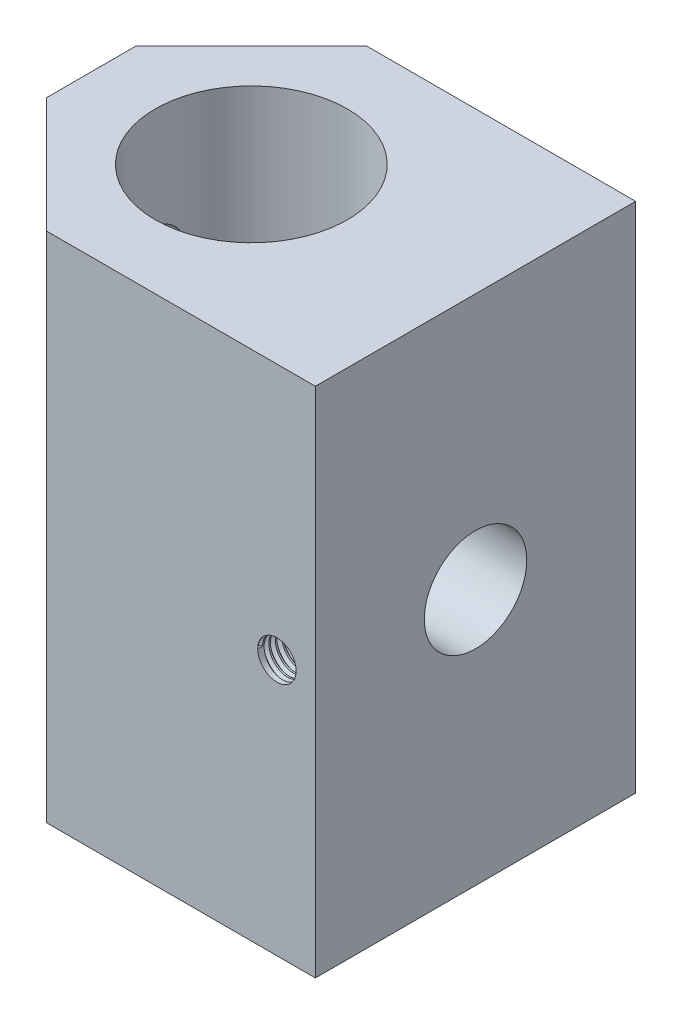
from build123d import *
from build123d.topology import SkipClean

# Parameters (mm, degrees)
SKETCH1_W           = 30
SKETCH1_H           = 25
SKETCH1_R           = 7.5
BOSS_EXTRUDE1_DEPTH = 20
SKETCH2_R           = 4
CUT_EXTRUDE1_DEPTH  = 9
SKETCH3_R           = 2
CUT_EXTRUDE2_DEPTH  = 10
CHAMFER1_SIZE       = 9
SKETCH4_R           = 1.5
CUT_EXTRUDE3_DEPTH  = 11
THREAD1_PITCH       = 0.5


with BuildPart() as part:
    # Sketch1 → Boss-Extrude1 (new, symmetric)
    with BuildSketch(Plane(origin=(0, 0, 0), x_dir=(1, 0, 0), z_dir=(0, 1, 0))):
        Rectangle(SKETCH1_W, SKETCH1_H)
        with Locations(Location((-2.5, 0, 0), (0, 0, 270))):
            Circle(SKETCH1_R, mode=Mode.SUBTRACT)
    extrude(amount=BOSS_EXTRUDE1_DEPTH, both=True)

    # Sketch2 → Cut-Extrude1 (cut)
    with BuildSketch(Plane(origin=(15, 0, 0), x_dir=(0, 0, -1), z_dir=(1, 0, 0))):
        Circle(SKETCH2_R)
    extrude(amount=-CUT_EXTRUDE1_DEPTH, mode=Mode.SUBTRACT)

    # Sketch3 → Cut-Extrude2 (cut)
    with BuildSketch(Plane.ZY.offset(15)):
        with Locations((0, -10)):
            Circle(SKETCH3_R)
        with Locations((0, 10)):
            Circle(SKETCH3_R)
    extrude(amount=-CUT_EXTRUDE2_DEPTH, mode=Mode.SUBTRACT)

    # Chamfer1
    chamfer1_edges = [part.edges().sort_by_distance(p)[0] for p in [
        (-15, 0, 12.5),
        (-15, 0, -12.5),
    ]]
    chamfer(chamfer1_edges, length=CHAMFER1_SIZE)

    # Sketch4 → Cut-Extrude3 (cut)
    with BuildSketch(Plane.XY.offset(12.5)):
        with Locations((12, 0)):
            Circle(SKETCH4_R)
    extrude(amount=-CUT_EXTRUDE3_DEPTH, mode=Mode.SUBTRACT)

    # Thread1: the profile of Thread Profile1 profile screwed along a right-hand helix of 22 turns, 6 arcs to a turn; built about Z, then put on its axis
    with SkipClean():  # the faces are left unmerged after this step: merging them gives an invalid solid
        thread1_z = Axis((0, 0, 0), (0, 0, 1))
        thread1_corners = [(1.4997, 0, -0.000173205), (1.770632938, 0, 0.156249999), (1.770632938, 0, 0.218749999), (1.4997, 0, 0.375173204)]
        with BuildLine(mode=Mode.PRIVATE) as thread1_profile:
            Line(thread1_corners[0], thread1_corners[1])
            Line(thread1_corners[1], thread1_corners[2])
            Line(thread1_corners[2], thread1_corners[3])
            Line(thread1_corners[3], thread1_corners[0])
        thread1_cap = Face(thread1_profile.wire())
        thread1_turn_angles = [0, 30, 60, 90, 120, 150, 180, 210, 240, 270, 300, 330, 360]
        thread1_turn_weights = [1, 0.8660254037844387, 1, 0.8660254037844387, 1, 0.8660254037844387, 1, 0.8660254037844387, 1, 0.8660254037844387, 1, 0.8660254037844387, 1]
        thread1_turn_rails = [Edge.make_bspline([Vector(p[0], p[1], 0).rotate(thread1_z, thread1_turn_angles[k]) / thread1_turn_weights[k] + Vector(0, 0, p[2] + THREAD1_PITCH * thread1_turn_angles[k] / 360) for k in range(13)], [0, 0, 0, 1, 1, 2, 2, 3, 3, 4, 4, 5, 5, 6, 6, 6], 2, thread1_turn_weights) for p in thread1_corners]
        thread1_turn_sides = [Face.make_surface_from_curves(thread1_turn_rails[p[0]], thread1_turn_rails[p[1]]) for p in [(0, 1), (1, 2), (2, 3), (3, 0)]]
        thread1 = Plane(origin=(12, 0, 12.5), x_dir=(-1, 0, 0), z_dir=(0, 0, -1)) * Solid(Shell([*[p.moved(Location((0, 0, THREAD1_PITCH * i))) for i in range(22) for p in thread1_turn_sides], thread1_cap, thread1_cap.rotate(thread1_z, 7920).moved(Location((0, 0, THREAD1_PITCH * 7920 / 360)))]))
        add(thread1, mode=Mode.SUBTRACT)


solid = part.part
